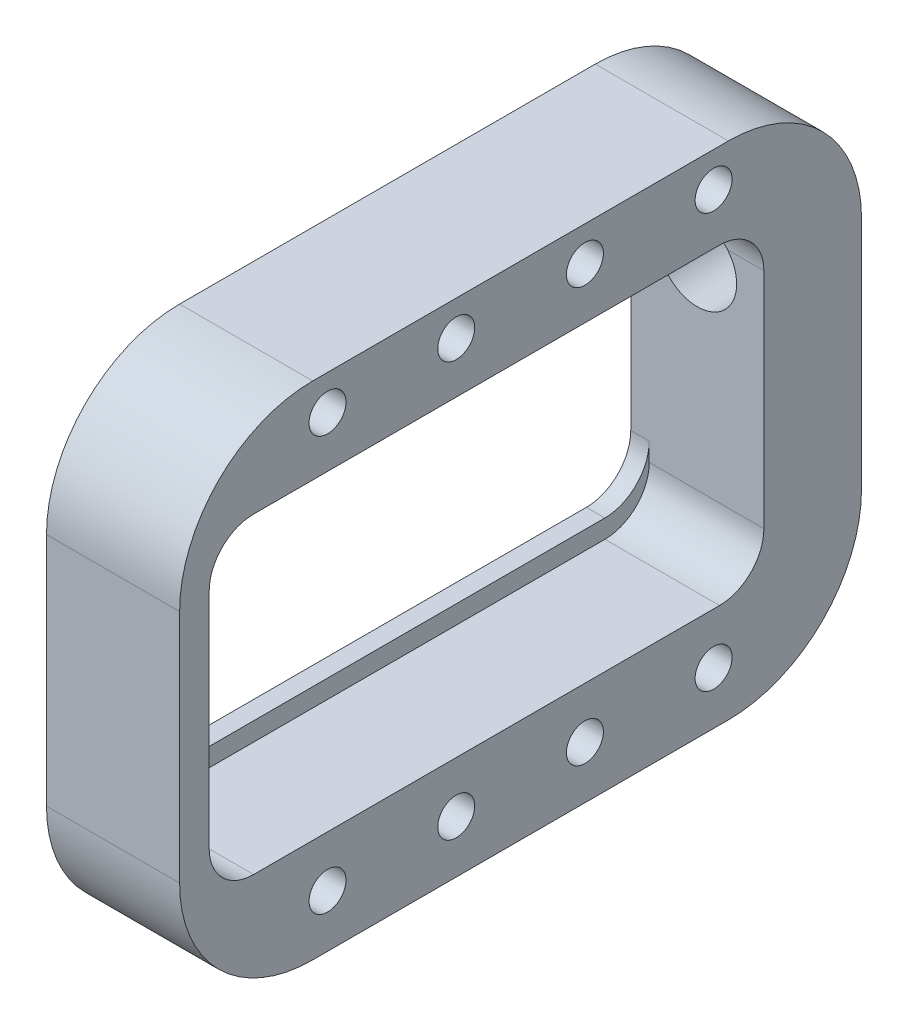
from build123d import *

# Parameters (mm, degrees)
SKETCH1_W                   = 58.547
SKETCH1_H                   = 44.577
SKETCH1_W_2                 = 47.625
SKETCH1_H_2                 = 26.797
BOSS_EXTRUDE1_DEPTH         = 5.715
BOSS_EXTRUDE2_REACH         = 57.19
SKETCH9_W                   = 1.5875
SKETCH9_H                   = 1.5875
FILLET11_R                  = 3.81
FILLET12_R                  = 3.81
F_1_4_CLEARANCE_HOLE1_D     = 6.7564
F_1_4_CLEARANCE_HOLE1_DEPTH = 8.89
F_1_4_CLEARANCE_HOLE1_TIP   = 2.029827343
F_6_32_TAPPED_HOLE1_D       = 2.7051
SKETCH22_W                  = 58.547
SKETCH22_H                  = 9.177220827
CUT_EXTRUDE4_DEPTH          = 41.791028073
FILLET14_R                  = 11.43
FILLET13_R                  = 11.43
SKETCH24_R                  = 1.5875
CUT_EXTRUDE5_DEPTH          = 11.43


with BuildPart() as part:
    # Sketch1 → Boss-Extrude1 (new, symmetric)
    with BuildSketch(Plane(origin=(0, 0, 0), x_dir=(0, 0, -1), z_dir=(1, 0, 0))):
        with Locations((2.921, 0)):
            Rectangle(SKETCH1_W, SKETCH1_H)
        Rectangle(SKETCH1_W_2, SKETCH1_H_2, mode=Mode.SUBTRACT)
    extrude(amount=BOSS_EXTRUDE1_DEPTH, both=True)

    # Sketch9 → Boss-Extrude2 (add, up to next)
    with BuildSketch(Plane.XY.offset(-23.8125), mode=Mode.PRIVATE) as boss_extrude2_sk1:
        with Locations((-4.92125, 12.60475)):
            Rectangle(SKETCH9_W, SKETCH9_H)
    boss_extrude2_tool1 = extrude(boss_extrude2_sk1.sketch, amount=BOSS_EXTRUDE2_REACH, mode=Mode.PRIVATE) - part.part
    # Sketch9 → Boss-Extrude2 (add, up to next)
    with BuildSketch(Plane.XY.offset(-23.8125), mode=Mode.PRIVATE) as boss_extrude2_sk2:
        with Locations((-4.92125, -12.60475)):
            Rectangle(SKETCH9_W, SKETCH9_H)
    boss_extrude2_tool2 = extrude(boss_extrude2_sk2.sketch, amount=BOSS_EXTRUDE2_REACH, mode=Mode.PRIVATE) - part.part
    add(boss_extrude2_tool1.solids().sort_by_distance((-4.92125, 12.60475, -23.8125))[0])
    add(boss_extrude2_tool2.solids().sort_by_distance((-4.92125, -12.60475, -23.8125))[0])

    # Fillet11
    fillet11_edges = [part.edges().sort_by_distance(p)[0] for p in [
        (-4.92125, -11.811, 23.8125),
        (-4.92125, -11.811, -23.8125),
        (-4.92125, 11.811, 23.8125),
        (-4.92125, 11.811, -23.8125),
    ]]
    fillet(fillet11_edges, radius=FILLET11_R)

    # Fillet12
    fillet12_edges = [part.edges().sort_by_distance(p)[0] for p in [
        (0.79375, 13.3985, 23.8125),
        (0.79375, -13.3985, 23.8125),
        (0.79375, -13.3985, -23.8125),
        (0.79375, 13.3985, -23.8125),
    ]]
    fillet(fillet12_edges, radius=FILLET12_R)

    # 1/4 Clearance Hole1
    with Locations(Plane(origin=(-2.530789808, 6.493019647, -32.1945), x_dir=(1, 0, 0), z_dir=(0, 0, -1))):
        with Locations((2.530789808, -0.936480353)):
            Hole(F_1_4_CLEARANCE_HOLE1_D / 2, depth=F_1_4_CLEARANCE_HOLE1_DEPTH)
            with Locations((0, 0, -(F_1_4_CLEARANCE_HOLE1_DEPTH + F_1_4_CLEARANCE_HOLE1_TIP / 2))):  # 118° drill point
                Cone(0, F_1_4_CLEARANCE_HOLE1_D / 2, F_1_4_CLEARANCE_HOLE1_TIP, mode=Mode.SUBTRACT)

    # #6-32 Tapped Hole1 (through all)
    with Locations(Plane(origin=(5.715, 17.955600219, 19.212274833), x_dir=(0, 0, 1), z_dir=(1, 0, 0))):
        with Locations((-27.657774833, 0.175600219), (-16.608774833, 0.175600219), (-5.559774833, 0.175600219), (-38.706774833, 0.175600219), (-38.706774833, 35.735600219), (-27.657774833, 35.735600219), (-16.608774833, 35.735600219), (-5.559774833, 35.735600219)):
            Hole(F_6_32_TAPPED_HOLE1_D / 2)

    # Sketch22 → Cut-Extrude4 (cut, through all)
    with BuildSketch(Plane.ZY.offset(5.715)):
        with Locations((-2.921, 25.353110414)):
            Rectangle(SKETCH22_W, SKETCH22_H)
    extrude(amount=-CUT_EXTRUDE4_DEPTH, mode=Mode.SUBTRACT)

    # Fillet14
    fillet14_edges = [part.edges().sort_by_distance(p)[0] for p in [
        (0, 20.7645, 26.3525),
        (0, -22.2885, 26.3525),
    ]]
    fillet(fillet14_edges, radius=FILLET14_R)

    # Fillet13
    # the kernel refuses this fillet: 11.43 mm, written as the material it takes off along each edge
    with BuildSketch(Plane(origin=(-34.29, 20.7645, -32.1945), x_dir=(0, 0, 1), z_dir=(1, 0, 0)), Plane(origin=(34.29, -22.2885, -32.1945), x_dir=(0, 0, 1), z_dir=(-1, 0, 0))) as fillet13_piece_1:
        with BuildLine():
            CenterArc((FILLET13_R, FILLET13_R), FILLET13_R, 180, 90)
            Line((0, FILLET13_R), (0, 0))
            Line((0, 0), (FILLET13_R, 0))
        make_face()
    extrude(amount=68.58, mode=Mode.SUBTRACT)

    # Sketch24 → Cut-Extrude5 (cut)
    with BuildSketch(Plane(origin=(5.715, 0, 0), x_dir=(0, 0, -1), z_dir=(1, 0, 0))):
        with Locations((19.4945, -17.78)):
            Circle(SKETCH24_R)
        with Locations((8.4455, -17.78)):
            Circle(SKETCH24_R)
        with Locations((-2.6035, -17.78)):
            Circle(SKETCH24_R)
        with Locations((-13.6525, -17.78)):
            Circle(SKETCH24_R)
        with Locations((-13.6525, 17.78)):
            Circle(SKETCH24_R)
        with Locations((-2.6035, 17.78)):
            Circle(SKETCH24_R)
        with Locations((8.4455, 17.78)):
            Circle(SKETCH24_R)
        with Locations((19.4945, 17.78)):
            Circle(SKETCH24_R)
    extrude(amount=-CUT_EXTRUDE5_DEPTH, mode=Mode.SUBTRACT)


solid = part.part
